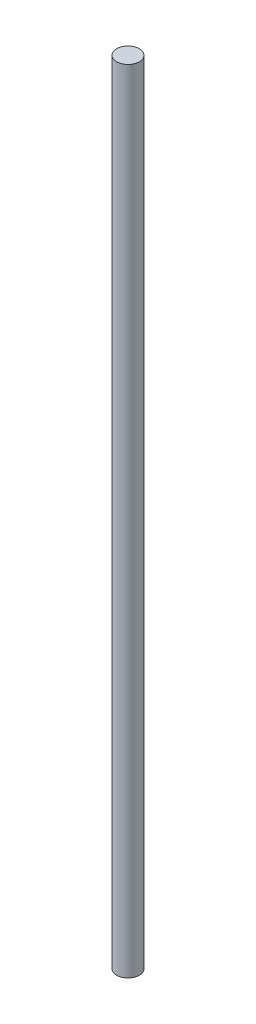
from build123d import *

# Parameters (mm, degrees)
SKETCH1_R           = 4
BOSS_EXTRUDE1_DEPTH = 280


with BuildPart() as part:
    # Sketch1 → Boss-Extrude1 (new body)
    with BuildSketch(Plane(origin=(0, 0, 0), x_dir=(1, 0, 0), z_dir=(0, 1, 0))):
        Circle(SKETCH1_R)
    extrude(amount=BOSS_EXTRUDE1_DEPTH)


solid = part.part
